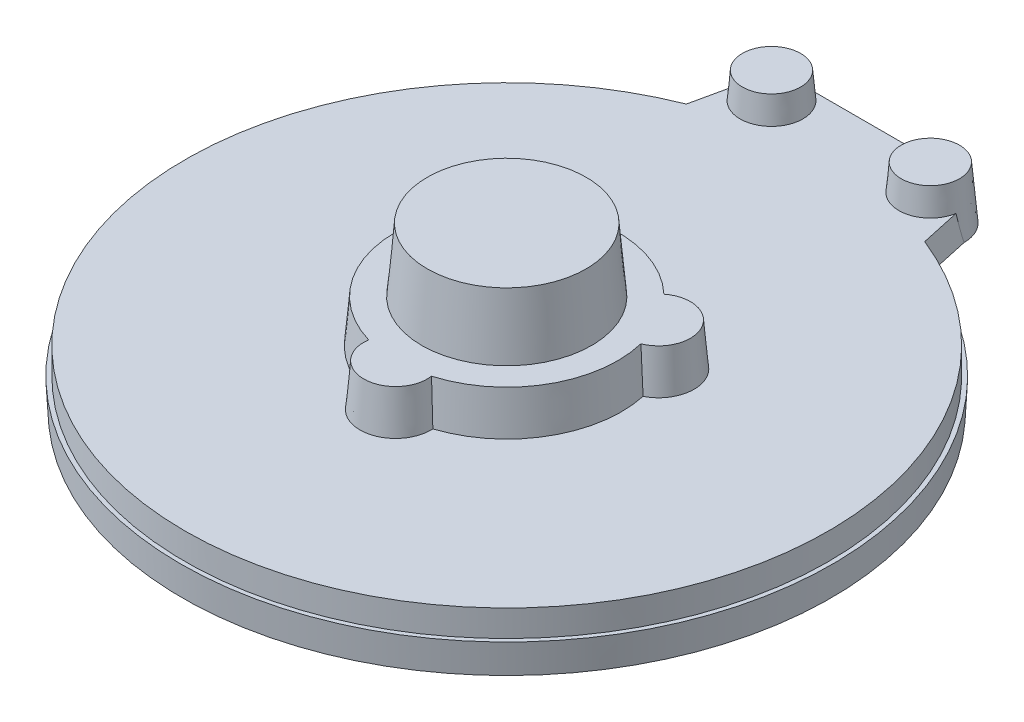
from build123d import *
from build123d.topology import SkipClean

# Parameters (mm, degrees)
SKETCH1_R                      = 60.75
BOSS_EXTRUDE1_DEPTH            = 8
BOSS_EXTRUDE3_DEPTH            = 8
SKETCH3_R                      = 15
SKETCH3_R_2                    = 10
BOSS_EXTRUDE4_DEPTH            = 12
BOSS_EXTRUDE5_START            = -5
BOSS_EXTRUDE5_DEPTH            = 5
SKETCH5_R                      = 5.500000000000001
SKETCH5_R_2                    = 5.499999999999997
BOSS_EXTRUDE6_DEPTH            = 5
SKETCH11_R                     = 52
CUT_EXTRUDE4_DEPTH             = 1
SKETCH12_R                     = 42.5
CUT_EXTRUDE5_DEPTH             = 4
BOSS_EXTRUDE7_START            = 2
SKETCH13_R                     = 21
SKETCH13_R_2                   = 10
BOSS_EXTRUDE7_DEPTH            = 2
BOSS_EXTRUDE8_START            = 2.2
SKETCH14_R                     = 60.75
SKETCH14_R_2                   = 52.000000000000014
BOSS_EXTRUDE8_DEPTH            = 2.2
BOSS_EXTRUDE9_START            = 2.2
SKETCH15_R                     = 52.000000000000014
SKETCH15_R_2                   = 42.500000000000014
BOSS_EXTRUDE9_DEPTH            = 2.2
BOSS_EXTRUDE10_START           = 2.2
SKETCH16_R                     = 42.50000000000002
SKETCH16_R_2                   = 21
BOSS_EXTRUDE10_DEPTH           = 2.2
BOSS_EXTRUDE11_START           = 2.2
SKETCH17_R                     = 21
SKETCH17_R_2                   = 10
BOSS_EXTRUDE11_DEPTH           = 2.2
BOSS_EXTRUDE12_REACH           = 99.841
SKETCH20_R                     = 14.5
CUT_EXTRUDE6_DEPTH             = 6
BOSS_EXTRUDE13_START           = 6
SKETCH22_R                     = 14.5
BOSS_EXTRUDE13_DEPTH           = 6
SKETCH23_R                     = 10
BOSS_EXTRUDE14_DEPTH           = 12
CUT_EXTRUDE7_START             = -12
SKETCH24_R                     = 15
CUT_EXTRUDE7_DEPTH             = 12
CUT_EXTRUDE8_START             = -8
CUT_EXTRUDE8_DEPTH             = 8
BOSS_EXTRUDE16_DEPTH           = 8
BOSS_EXTRUDE16_DRAFT           = 5
SKETCH25_R                     = 15
BOSS_EXTRUDE15_DEPTH           = 12
BOSS_EXTRUDE15_DRAFT           = 5.000000000000003
CUT_EXTRUDE9_START             = -5
SKETCH29_R                     = 5.500000000000004
SKETCH29_R_2                   = 5.499999999999987
CUT_EXTRUDE9_DEPTH             = 5
SKETCH30_R                     = 5.499999999999987
BOSS_EXTRUDE17_DEPTH           = 10
BOSS_EXTRUDE17_DRAFT           = 5.000000000000003
SKETCH30_R_2                   = 5.500000000000005
BOSS_EXTRUDE17_PROFILE_2_DEPTH = 10
BOSS_EXTRUDE17_PROFILE_2_DRAFT = 5.000000000000003
CUT_EXTRUDE14_START            = 10
SKETCH40_R                     = 42.75
SKETCH40_R_2                   = 21
CUT_EXTRUDE14_DEPTH            = 10
SKETCH43_R                     = 20.82502267294815
BOSS_EXTRUDE19_DEPTH           = 1
BOSS_EXTRUDE19_TAPER           = 5.000000000000003
SKETCH45_R                     = 61.25
SKETCH45_R_2                   = 60.75
BOSS_EXTRUDE21_DEPTH           = 5.7
BOSS_EXTRUDE21_DRAFT           = 3.000000000000002
BOSS_EXTRUDE22_START           = 0.5
SKETCH46_R                     = 60.75
BOSS_EXTRUDE22_DEPTH           = 0.5
SKETCH47_R                     = 22
SKETCH48_R                     = 21.25
SKETCH50_R                     = 43.099954654103705
SKETCH50_R_2                   = 42.25000000000001
BOSS_EXTRUDE23_DEPTH           = 4
BOSS_EXTRUDE23_DRAFT           = 25.000000000000018


# Read off the part's stored shape, not the designer's step: Boss-Extrude16, Cut-Extrude15
with BuildPart() as part:
    # Sketch1 → Boss-Extrude1 (new body)
    with BuildSketch(Plane(origin=(0, 0, 0), x_dir=(1, 0, 0), z_dir=(0, 1, 0))):
        with Locations(Location((0, 0, 0), (0, 0, 270))):
            Circle(SKETCH1_R)
    extrude(amount=BOSS_EXTRUDE1_DEPTH)

    # Sketch2 → Boss-Extrude3 (add)
    with BuildSketch(Plane(origin=(0, 8, 0), x_dir=(1, 0, 0), z_dir=(0, 1, 0))):
        with BuildLine():
            ThreePointArc((5.938459911664728, -20.142857142857142), (-6.444e-14, -27.000000000000057), (-5.938459911664823, -20.142857142857114))
            ThreePointArc((-5.938459911664823, -20.142857142857114), (-18.186533479473233, -10.499999999999973), (-20.413455946347497, 4.928571428571383))
            ThreePointArc((-20.413455946347497, 4.928571428571383), (-23.382685902179873, 13.499999999999936), (-14.474996034682798, 15.214285714285683))
            ThreePointArc((-14.474996034682798, 15.214285714285683), (1.29e-15, 21.000000000000004), (14.474996034682793, 15.214285714285687))
            ThreePointArc((14.474996034682793, 15.214285714285687), (23.38268590217988, 13.499999999999948), (20.413455946347494, 4.928571428571376))
            ThreePointArc((20.413455946347494, 4.928571428571376), (18.186533479473198, -10.500000000000021), (5.938459911664728, -20.142857142857142))
        make_face()
    extrude(amount=BOSS_EXTRUDE3_DEPTH)

    # Sketch3 → Boss-Extrude4 (add)
    with BuildSketch(Plane(origin=(0, 16, 0), x_dir=(1, 0, 0), z_dir=(0, 1, 0))):
        with Locations(Location((0, 0, 0), (0, 0, 270))):
            Circle(SKETCH3_R)
        with Locations(Location((0, 0, 0), (0, 0, 270))):
            Circle(SKETCH3_R_2, mode=Mode.SUBTRACT)
    extrude(amount=BOSS_EXTRUDE4_DEPTH)

    # Sketch4 → Boss-Extrude5 (add)
    with BuildSketch(Plane(origin=(0, 8, 0), x_dir=(1, 0, 0), z_dir=(0, 1, 0)).offset(BOSS_EXTRUDE5_START)):
        with BuildLine():
            Line((-15.000000000000002, 70.5), (15.000000000000002, 70.5))
            ThreePointArc((15.000000000000002, 70.5), (18.449606964363085, 69.2837147187246), (20.37350259165708, 66.17280428778827))
            Line((20.37350259165708, 66.17280428778827), (22.5, 56.42971291793003))
            ThreePointArc((22.5, 56.42971291793003), (3.72e-15, 60.75), (-22.5, 56.42971291793003))
            Line((-22.5, 56.42971291793003), (-20.37350259165708, 66.17280428778827))
            ThreePointArc((-20.37350259165708, 66.17280428778827), (-18.449606964363085, 69.2837147187246), (-15.000000000000002, 70.5))
        make_face()
    extrude(amount=BOSS_EXTRUDE5_DEPTH)

    # Sketch5 → Boss-Extrude6 (add)
    with SkipClean():  # the faces are left unmerged after this step: merging them gives an invalid solid
        with BuildSketch(Plane(origin=(0, 8, 0), x_dir=(1, 0, 0), z_dir=(0, 1, 0))):
            with Locations(Location((-15, 64.99999999999999, 0), (0, 0, 270))):
                Circle(SKETCH5_R)
            with Locations(Location((15, 64.99999999999999, 0), (0, 0, 90))):
                Circle(SKETCH5_R_2)
        extrude(amount=BOSS_EXTRUDE6_DEPTH)

    # Sketch11 → Cut-Extrude4 (cut)
    with SkipClean():  # the faces are left unmerged after this step: merging them gives an invalid solid
        with BuildSketch(Plane.XZ):
            with Locations(Location((0, 0, 0), (0, 0, 270))):
                Circle(SKETCH11_R)
        extrude(amount=-CUT_EXTRUDE4_DEPTH, mode=Mode.SUBTRACT)

    # Sketch12 → Cut-Extrude5 (cut)
    with SkipClean():  # the faces are left unmerged after this step: merging them gives an invalid solid
        with BuildSketch(Plane.XZ.offset(-1)):
            with Locations(Location((0, 0, 0), (0, 0, 270))):
                Circle(SKETCH12_R)
        extrude(amount=-CUT_EXTRUDE5_DEPTH, mode=Mode.SUBTRACT)

    # Sketch13 → Boss-Extrude7 (add)
    with SkipClean():  # the faces are left unmerged after this step: merging them gives an invalid solid
        with BuildSketch(Plane.XZ.offset(-5).offset(BOSS_EXTRUDE7_START)):
            with Locations(Location((0, 0, 0), (0, 0, 270))):
                Circle(SKETCH13_R)
            with Locations(Location((0, 0, 0), (0, 0, 90))):
                Circle(SKETCH13_R_2, mode=Mode.SUBTRACT)
        extrude(amount=-BOSS_EXTRUDE7_DEPTH)

    # Sketch14 → Boss-Extrude8 (add)
    with BuildSketch(Plane.XZ.offset(BOSS_EXTRUDE8_START)):
        with Locations(Location((0, 0, 0), (0, 0, 270))):
            Circle(SKETCH14_R)
        with Locations(Location((0, 0, 0), (0, 0, 270))):
            Circle(SKETCH14_R_2, mode=Mode.SUBTRACT)
    extrude(amount=-BOSS_EXTRUDE8_DEPTH)

    # Sketch15 → Boss-Extrude9 (add)
    with BuildSketch(Plane.XZ.offset(-1).offset(BOSS_EXTRUDE9_START)):
        with Locations(Location((0, 0, 0), (0, 0, 270))):
            Circle(SKETCH15_R)
        with Locations(Location((0, 0, 0), (0, 0, 270))):
            Circle(SKETCH15_R_2, mode=Mode.SUBTRACT)
    extrude(amount=-BOSS_EXTRUDE9_DEPTH)

    # Sketch16 → Boss-Extrude10 (add)
    with BuildSketch(Plane.XZ.offset(-5).offset(BOSS_EXTRUDE10_START)):
        with Locations(Location((0, 0, 0), (0, 0, 270))):
            Circle(SKETCH16_R)
        with Locations(Location((0, 0, 0), (0, 0, 270))):
            Circle(SKETCH16_R_2, mode=Mode.SUBTRACT)
    extrude(amount=-BOSS_EXTRUDE10_DEPTH)

    # Sketch17 → Boss-Extrude11 (add)
    with BuildSketch(Plane.XZ.offset(-3).offset(BOSS_EXTRUDE11_START)):
        with Locations(Location((0, 0, 0), (0, 0, 270))):
            Circle(SKETCH17_R)
        with Locations(Location((0, 0, 0), (0, 0, 90))):
            Circle(SKETCH17_R_2, mode=Mode.SUBTRACT)
    extrude(amount=-BOSS_EXTRUDE11_DEPTH)

    # Sketch18 → Boss-Extrude12 (add, up to next)
    with BuildSketch(Plane.XZ.offset(2.2), mode=Mode.PRIVATE) as boss_extrude12_sk1:
        with BuildLine():
            ThreePointArc((0, 52), (-0.01568724474421835, 51.99999763375334), (-0.03137448806074861, 51.99999053501355))
            ThreePointArc((-0.03137448806074783, 51.99999053501355), (1.9030265971459484, 51.294569899693556), (2.9270643996395953, 49.508268578457944))
            ThreePointArc((2.9270643996395966, 49.508268578457944), (9.148114395981406, 43.03849443228744), (17.46282057957898, 46.41859822357625))
            ThreePointArc((17.46282057957898, 46.41859822357625), (19.124879865422606, 47.63395198340303), (21.178963611238554, 47.49159399676782))
            ThreePointArc((21.17896361123856, 47.491593996767826), (10.826751871361822, 50.86041136204036), (3.18e-15, 52.00000000000001))
        make_face()
    boss_extrude12_tool1 = extrude(boss_extrude12_sk1.sketch, amount=-BOSS_EXTRUDE12_REACH, mode=Mode.PRIVATE) - part.part
    # Sketch18 → Boss-Extrude12 (add, up to next)
    with BuildSketch(Plane.XZ.offset(2.2), mode=Mode.PRIVATE) as boss_extrude12_sk2:
        with BuildLine():
            ThreePointArc((0.03137448806111159, -51.99999053501355), (-1.9030265971455897, -51.29456989969357), (-2.9270643996392525, -49.508268578457965))
            ThreePointArc((-2.9270643996392494, -49.508268578457965), (-9.148114395981109, -43.0384944322875), (-17.46282057957866, -46.418598223576375))
            ThreePointArc((-17.46282057957866, -46.418598223576375), (-19.124879865422272, -47.633951983403165), (-21.17896361123822, -47.49159399676797))
            ThreePointArc((-21.17896361123824, -47.49159399676797), (-10.81140792252315, -50.863675238157974), (0.03137448806108981, -51.99999053501356))
        make_face()
    boss_extrude12_tool2 = extrude(boss_extrude12_sk2.sketch, amount=-BOSS_EXTRUDE12_REACH, mode=Mode.PRIVATE) - part.part
    add(boss_extrude12_tool1.solids().sort_by_distance((10.097222, -2.2, 47.503693))[0])
    add(boss_extrude12_tool2.solids().sort_by_distance((-10.097222, -2.2, -47.503693))[0])

    # Sketch20 → Cut-Extrude6 (cut)
    with BuildSketch(Plane.XZ.offset(-0.7999999999999999)):
        with Locations(Location((0, 0, 0), (0, 0, 270))):
            Circle(SKETCH20_R)
    extrude(amount=-CUT_EXTRUDE6_DEPTH, mode=Mode.SUBTRACT)

    # Sketch22 → Boss-Extrude13 (add)
    with BuildSketch(Plane.XZ.offset(-6.800000000000001).offset(BOSS_EXTRUDE13_START)):
        Circle(SKETCH22_R)
    extrude(amount=-BOSS_EXTRUDE13_DEPTH)

    # Sketch23 → Boss-Extrude14 (add)
    with BuildSketch(Plane(origin=(0, 16, 0), x_dir=(1, 0, 0), z_dir=(0, 1, 0))):
        Circle(SKETCH23_R)
    extrude(amount=BOSS_EXTRUDE14_DEPTH)

    # Sketch24 → Cut-Extrude7 (cut)
    with BuildSketch(Plane(origin=(0, 28, 0), x_dir=(1, 0, 0), z_dir=(0, 1, 0)).offset(CUT_EXTRUDE7_START)):
        Circle(SKETCH24_R)
    extrude(amount=CUT_EXTRUDE7_DEPTH, mode=Mode.SUBTRACT)

    # Sketch26 → Cut-Extrude8 (cut)
    with BuildSketch(Plane(origin=(0, 16, 0), x_dir=(1, 0, 0), z_dir=(0, 1, 0)).offset(CUT_EXTRUDE8_START)):
        with BuildLine():
            ThreePointArc((5.938459911664719, -20.142857142857142), (18.186533479473198, -10.500000000000023), (20.413455946347494, 4.928571428571378))
            ThreePointArc((20.413455946347494, 4.928571428571378), (23.38268590217988, 13.499999999999948), (14.474996034682793, 15.214285714285683))
            ThreePointArc((14.474996034682793, 15.214285714285683), (-8.04e-15, 21), (-14.474996034682805, 15.214285714285678))
            ThreePointArc((-14.474996034682805, 15.214285714285678), (-23.382685902179873, 13.49999999999994), (-20.4134559463475, 4.928571428571381))
            ThreePointArc((-20.4134559463475, 4.928571428571381), (-18.186533479473237, -10.499999999999975), (-5.938459911664835, -20.142857142857114))
            ThreePointArc((-5.938459911664835, -20.142857142857114), (-6.191e-14, -27.000000000000068), (5.938459911664719, -20.142857142857142))
        make_face()
    extrude(amount=CUT_EXTRUDE8_DEPTH, mode=Mode.SUBTRACT)


with BuildPart() as boss_extrude16_tool:
    # Boss-Extrude16 outline → Boss-Extrude16 (with draft: the straight prism first)
    with BuildSketch(Plane(origin=(0, 16, 0), x_dir=(1, 0, 0), z_dir=(0, 1, 0))):
        with BuildLine():
            ThreePointArc((-5.938459912, -20.142857143), (0, -27), (5.938459912, -20.142857143))
            ThreePointArc((5.938459912, -20.142857143), (18.186533479, -10.5), (20.413455946, 4.928571429))
            ThreePointArc((20.413455946, 4.928571429), (23.382685902, 13.5), (14.474996035, 15.214285714))
            ThreePointArc((14.474996035, 15.214285714), (0, 21), (-14.474996035, 15.214285714))
            ThreePointArc((-14.474996035, 15.214285714), (-23.382685902, 13.5), (-20.413455946, 4.928571429))
            ThreePointArc((-20.413455946, 4.928571429), (-18.186533479, -10.5), (-5.938459912, -20.142857143))
        make_face()
    extrude(amount=-BOSS_EXTRUDE16_DEPTH)
    # Boss-Extrude16: the draft: its side faces are tilted about the plane it starts from
    boss_extrude16_sides = [boss_extrude16_tool.faces().sort_by_distance(p)[0] for p in [
        (0, 12, 27),
        (18.186533479, 12, 10.5),
        (23.382685902, 12, -13.5),
        (0, 12, -21),
        (-23.382685902, 12, -13.5),
        (-18.186533479, 12, 10.5),
    ]]
    draft(boss_extrude16_sides, Plane(origin=(0, 16, 0), x_dir=(1, 0, 0), z_dir=(0, 1, 0)), BOSS_EXTRUDE16_DRAFT)


with BuildPart() as part_1:
    add(part.part)

    # Boss-Extrude16: add boss_extrude16_tool
    add(boss_extrude16_tool.part)

    # Sketch29 → Cut-Extrude9 (cut)
    with BuildSketch(Plane(origin=(0, 13.000000000000002, 0), x_dir=(1, 0, 0), z_dir=(0, 1, 0)).offset(CUT_EXTRUDE9_START)):
        with Locations((-15, 64.99999999999999)):
            Circle(SKETCH29_R)
        with Locations((15, 64.99999999999999)):
            Circle(SKETCH29_R_2)
    extrude(amount=CUT_EXTRUDE9_DEPTH, mode=Mode.SUBTRACT)


with BuildPart() as body_2:
    # Sketch25 → Boss-Extrude15 (with draft: the straight prism first)
    with BuildSketch(Plane(origin=(0, 28, 0), x_dir=(1, 0, 0), z_dir=(0, 1, 0))):
        Circle(SKETCH25_R)
    extrude(amount=-BOSS_EXTRUDE15_DEPTH)
    # Boss-Extrude15: the draft: its side faces are tilted about the plane it starts from
    boss_extrude15_sides = [body_2.faces().sort_by_distance(p)[0] for p in [
        (-15, 22, 0),
    ]]
    draft(boss_extrude15_sides, Plane(origin=(0, 28, 0), x_dir=(1, 0, 0), z_dir=(0, 1, 0)), BOSS_EXTRUDE15_DRAFT)


with BuildPart() as boss_extrude17_tool:
    # Sketch30 → Boss-Extrude17 (with draft: the straight prism first)
    with BuildSketch(Plane(origin=(0, 13.000000000000002, 0), x_dir=(1, 0, 0), z_dir=(0, 1, 0))):
        with Locations((15, 64.99999999999999)):
            Circle(SKETCH30_R)
    extrude(amount=-BOSS_EXTRUDE17_DEPTH)
    # Boss-Extrude17: the draft: its side faces are tilted about the plane it starts from
    boss_extrude17_sides = [boss_extrude17_tool.faces().sort_by_distance(p)[0] for p in [
        (9.5, 8, -65),
    ]]
    draft(boss_extrude17_sides, Plane(origin=(0, 13.000000000000002, 0), x_dir=(1, 0, 0), z_dir=(0, 1, 0)), BOSS_EXTRUDE17_DRAFT)


with BuildPart() as part_2:
    add(part_1.part)

    # Boss-Extrude17: add boss_extrude17_tool
    add(boss_extrude17_tool.part)


with BuildPart() as boss_extrude17_profile_2_tool:
    # Sketch30 → Boss-Extrude17 profile 2 (with draft: the straight prism first)
    with BuildSketch(Plane(origin=(0, 13.000000000000002, 0), x_dir=(1, 0, 0), z_dir=(0, 1, 0))):
        with Locations((-15, 64.99999999999999)):
            Circle(SKETCH30_R_2)
    extrude(amount=-BOSS_EXTRUDE17_PROFILE_2_DEPTH)
    # Boss-Extrude17 profile 2: the draft: its side faces are tilted about the plane it starts from
    boss_extrude17_profile_2_sides = [boss_extrude17_profile_2_tool.faces().sort_by_distance(p)[0] for p in [
        (-20.5, 8, -65),
    ]]
    draft(boss_extrude17_profile_2_sides, Plane(origin=(0, 13.000000000000002, 0), x_dir=(1, 0, 0), z_dir=(0, 1, 0)), BOSS_EXTRUDE17_PROFILE_2_DRAFT)


with BuildPart() as part_3:
    add(part_2.part)

    # Boss-Extrude17 profile 2: add boss_extrude17_profile_2_tool
    add(boss_extrude17_profile_2_tool.part)

    # Sketch35 for Loft1 → Loft1 section 0
    with BuildSketch(Plane(origin=(0, 8, 0), x_dir=(1, 0, 0), z_dir=(0, 1, 0))):
        with BuildLine():
            Line((-20.85046947506008, 63.987458607535004), (-22.500000000000007, 56.42971291793004))
            # circular arc as an exact rational Bezier (weights 1, cos(half-angle), 1)
            Bezier((-22.500000000000007, 56.42971291793004), (0, 65.401050425), (22.500000000000004, 56.42971291793004), weights=[1, 0.928884163258, 1])
            Line((22.500000000000004, 56.42971291793004), (20.85046947506007, 63.98745860753506))
            Bezier((20.85046947506007, 63.98745860753506), (22.675263086, 74.531125659), (12.763209185000878, 70.5), weights=[1, 0.485191442362, 1])
            Line((12.763209185000878, 70.5), (-12.763209185000829, 70.5))
            Bezier((-12.763209185000829, 70.5), (-22.675263086, 74.531125659), (-20.85046947506008, 63.987458607535004), weights=[1, 0.485191442362, 1])
        make_face()
    # Sketch34 for Loft1 → Loft1 section 1
    with BuildSketch(Plane.XZ.offset(-3)):
        with BuildLine():
            Line((-21.374886635259248, -65.00000000000003), (-23.318116732321744, -56.09659465651917))
            Bezier((-23.318116732321744, -56.09659465651917), (0, -65.789421312), (23.318116732321744, -56.09659465651917), weights=[1, 0.923400735087, 1])
            Line((23.318116732321744, -56.09659465651917), (21.374886635259248, -65.00000000000003))
            Bezier((21.374886635259248, -65.00000000000003), (21.374886635, -71.374886635), (15.000000000000066, -71.37488663525922), weights=[1, 0.707106781187, 1])
            Line((15.000000000000066, -71.37488663525922), (-14.999999999999934, -71.37488663525923))
            Bezier((-14.999999999999934, -71.37488663525923), (-21.374886635, -71.374886635), (-21.374886635259248, -65.00000000000003), weights=[1, 0.707106781187, 1])
        make_face()
    loft()

    # Sketch40 → Cut-Extrude14 (cut)
    with BuildSketch(Plane.XZ.offset(-2.8).offset(CUT_EXTRUDE14_START)):
        with Locations(Location((0, 0, 0), (0, 0, 270))):
            Circle(SKETCH40_R)
        with Locations(Location((0, 0, 0), (0, 0, 270))):
            Circle(SKETCH40_R_2, mode=Mode.SUBTRACT)
    extrude(amount=-CUT_EXTRUDE14_DEPTH, mode=Mode.SUBTRACT)

    # Cut-Extrude15 outline → Cut-Extrude15 (revolve, cut)
    with BuildSketch(Plane.XY):
        Polygon((42.75, 2.8), (42.75, -1.2), (43.099954654, -1.2), align=None)
        Polygon((21, 0.8), (21, 2.8), (20.825022673, 0.8), align=None)
    revolve(axis=Axis((0, 0, 0), (0, 1, 0)), mode=Mode.SUBTRACT)

    # Sketch43 → Boss-Extrude19 (add)
    with BuildSketch(Plane.XZ.offset(-0.7999999999999999)):
        Circle(SKETCH43_R)
    extrude(amount=BOSS_EXTRUDE19_DEPTH, taper=BOSS_EXTRUDE19_TAPER)


with BuildPart() as boss_extrude21_tool:
    # Sketch45 → Boss-Extrude21 (with draft: the straight prism first)
    with BuildSketch(Plane(origin=(0, -2.7, 0), x_dir=(-1, 0, 0), z_dir=(0, -1, 0))):
        Circle(SKETCH45_R)
        Circle(SKETCH45_R_2, mode=Mode.SUBTRACT)
    extrude(amount=-BOSS_EXTRUDE21_DEPTH)
    # Boss-Extrude21: the draft: its side faces are tilted about the plane it starts from
    boss_extrude21_sides = [boss_extrude21_tool.faces().sort_by_distance(p)[0] for p in [
        (61.25, 0.15, 0),
        (60.75, 0.15, 0),
    ]]
    draft(boss_extrude21_sides, Plane(origin=(0, -2.7, 0), x_dir=(-1, 0, 0), z_dir=(0, -1, 0)), BOSS_EXTRUDE21_DRAFT)


with BuildPart() as part_4:
    add(part_3.part)

    # Boss-Extrude21: add boss_extrude21_tool
    add(boss_extrude21_tool.part)

    # Sketch46 → Boss-Extrude22 (add)
    with BuildSketch(Plane.XZ.offset(2.2).offset(BOSS_EXTRUDE22_START)):
        Circle(SKETCH46_R)
        with BuildLine():
            ThreePointArc((-0.03137448806074879, 51.99999053501356), (-50.86367523815793, 10.811407922523328), (-21.178963611238228, -47.491593996767975))
            ThreePointArc((-21.178963611238228, -47.491593996767975), (-19.124879865422272, -47.63395198340318), (-17.46282057957866, -46.418598223576375))
            ThreePointArc((-17.46282057957866, -46.418598223576375), (-9.14811439598111, -43.0384944322875), (-2.9270643996392507, -49.508268578457965))
            ThreePointArc((-2.9270643996392507, -49.508268578457965), (-1.9030265971455884, -51.29456989969357), (0.03137448806111191, -51.99999053501356))
            ThreePointArc((0.03137448806111191, -51.99999053501356), (50.86367523815794, -10.81140792252331), (21.17896361123855, 47.491593996767826))
            ThreePointArc((21.17896361123855, 47.491593996767826), (19.124879865422596, 47.63395198340304), (17.462820579578977, 46.41859822357625))
            ThreePointArc((17.462820579578977, 46.41859822357625), (9.148114395981402, 43.03849443228744), (2.927064399639594, 49.50826857845795))
            ThreePointArc((2.927064399639594, 49.50826857845795), (1.9030265971459435, 51.294569899693556), (-0.03137448806074879, 51.99999053501356))
        make_face(mode=Mode.SUBTRACT)
    extrude(amount=-BOSS_EXTRUDE22_DEPTH)

    # Sketch47 → Loft4 section 0
    with BuildSketch(Plane.XZ.offset(-2.8)):
        Circle(SKETCH47_R)
    # Sketch48 → Loft4 section 1
    with BuildSketch(Plane.XZ.offset(0.2000000000000001)):
        Circle(SKETCH48_R)
    loft()


with BuildPart() as boss_extrude23_tool:
    # Sketch50 → Boss-Extrude23 (with draft: the straight prism first)
    with BuildSketch(Plane.XZ.offset(1.2000000000000002)):
        Circle(SKETCH50_R)
        Circle(SKETCH50_R_2, mode=Mode.SUBTRACT)
    extrude(amount=-BOSS_EXTRUDE23_DEPTH)
    # Boss-Extrude23: the draft: its side faces are tilted about the plane it starts from
    boss_extrude23_sides = [boss_extrude23_tool.faces().sort_by_distance(p)[0] for p in [
        (-43.099954654, 0.8, 0),
        (-42.25, 0.8, 0),
    ]]
    draft(boss_extrude23_sides, Plane.XZ.offset(1.2000000000000002), BOSS_EXTRUDE23_DRAFT)


with BuildPart() as part_5:
    add(part_4.part)

    # Boss-Extrude23: add boss_extrude23_tool
    add(boss_extrude23_tool.part)


solid = Compound([body_2.part, part_5.part])
